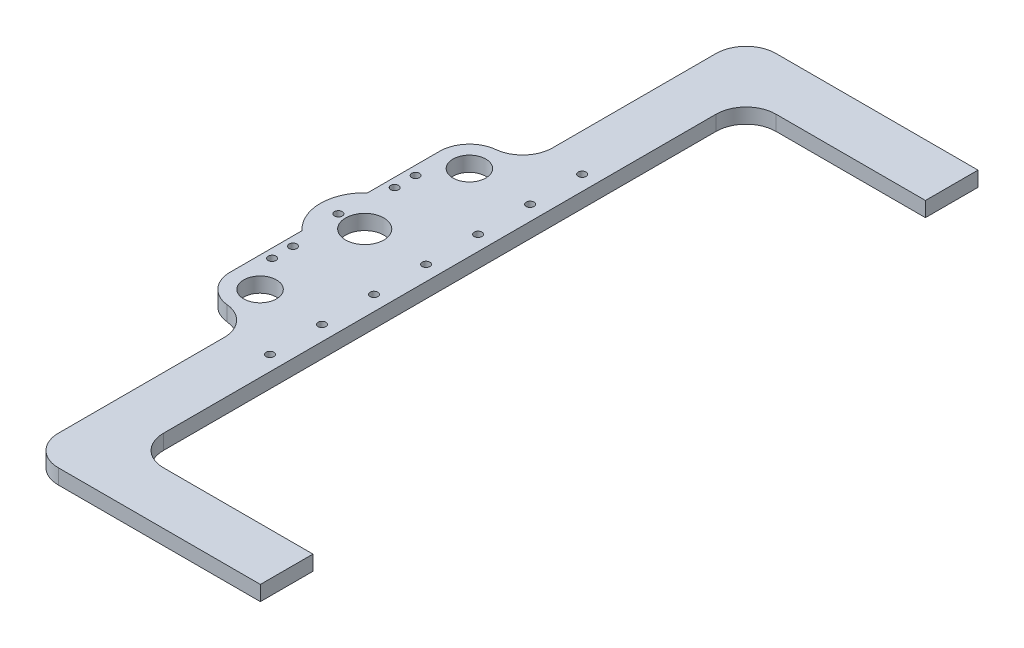
from build123d import *

# Parameters (mm, degrees)
SKETCH1_R           = 8.128
SKETCH1_R_2         = 6.985
SKETCH1_R_3         = 1.651
BOSS_EXTRUDE1_DEPTH = 6.35


with BuildPart() as part:
    # Sketch1 → Boss-Extrude1 (new body)
    with BuildSketch(Plane(origin=(0, 0, 0), x_dir=(1, 0, 0), z_dir=(0, 1, 0))):
        with BuildLine():
            Line((-67.971311517, -52.728298572), (-67.971311517, -82.586411585))
            ThreePointArc((-67.971311517, -82.586411585), (-64.941959488, -91.499608698), (-56.608448003, -95.878494725))
            ThreePointArc((-56.608448003, -95.878494725), (-48.492989851, -100.008926653), (-45.228378476, -108.509717293))
            Line((-45.228378476, -108.509717293), (-45.228378476, -114.997272158))
            Line((-45.228378476, -114.997272158), (-45.228378476, -128.204620988))
            Line((-45.228378476, -128.204620988), (-45.228378476, -179.004620988))
            ThreePointArc((-45.228378476, -179.004620988), (-41.508634597, -187.984877109), (-32.528378476, -191.704620988))
            Line((-32.528378476, -191.704620988), (-22.903517531, -191.704620988))
            Line((-22.903517531, -191.704620988), (53.296482469, -191.704620988))
            Line((53.296482469, -191.704620988), (53.296482469, -169.379760042))
            Line((53.296482469, -169.379760042), (-10.203517531, -169.379760042))
            ThreePointArc((-10.203517531, -169.379760042), (-19.183773652, -165.660016163), (-22.903517531, -156.679760042))
            Line((-22.903517531, -156.679760042), (-22.903517531, -128.204620988))
            Line((-22.903517531, -128.204620988), (-22.903517531, 49.595379012))
            Line((-22.903517531, 49.595379012), (-22.903517531, 78.070518067))
            ThreePointArc((-22.903517531, 78.070518067), (-19.183773652, 87.050774188), (-10.203517531, 90.770518067))
            Line((-10.203517531, 90.770518067), (53.296482469, 90.770518067))
            Line((53.296482469, 90.770518067), (53.296482469, 113.095379012))
            Line((53.296482469, 113.095379012), (-22.903517531, 113.095379012))
            Line((-22.903517531, 113.095379012), (-32.528378476, 113.095379012))
            ThreePointArc((-32.528378476, 113.095379012), (-41.508634597, 109.375635133), (-45.228378476, 100.395379012))
            Line((-45.228378476, 100.395379012), (-45.228378476, 49.595379012))
            Line((-45.228378476, 49.595379012), (-45.228378476, 37.402727842))
            Line((-45.228378476, 37.402727842), (-45.228378476, 30.915172977))
            ThreePointArc((-45.228378476, 30.915172977), (-48.492989851, 22.414382337), (-56.608448003, 18.28395041))
            ThreePointArc((-56.608448003, 18.28395041), (-64.941959488, 13.905064383), (-67.971311517, 4.991867269))
            Line((-67.971311517, 4.991867269), (-67.971311517, -24.866245744))
            ThreePointArc((-67.971311517, -24.866245744), (-74.128017531, -38.797272158), (-67.971311517, -52.728298572))
        make_face()
        with Locations((-55.288517531, -38.797272158)):
            Circle(SKETCH1_R, mode=Mode.SUBTRACT)
        with Locations((-55.288517531, 5.652727842)):
            Circle(SKETCH1_R_2, mode=Mode.SUBTRACT)
        with Locations((-55.288517531, -83.247272158)):
            Circle(SKETCH1_R_2, mode=Mode.SUBTRACT)
        with Locations((-29.253517531, -38.797272158)):
            Circle(SKETCH1_R_3, mode=Mode.SUBTRACT)
        with Locations((-29.253517531, -16.699272158)):
            Circle(SKETCH1_R_3, mode=Mode.SUBTRACT)
        with Locations((-29.253517531, 5.398727842)):
            Circle(SKETCH1_R_3, mode=Mode.SUBTRACT)
        with Locations((-29.253517531, 27.496727842)):
            Circle(SKETCH1_R_3, mode=Mode.SUBTRACT)
        with Locations((-29.253517531, -60.895272158)):
            Circle(SKETCH1_R_3, mode=Mode.SUBTRACT)
        with Locations((-29.253517531, -82.993272158)):
            Circle(SKETCH1_R_3, mode=Mode.SUBTRACT)
        with Locations((-29.253517531, -105.091272158)):
            Circle(SKETCH1_R_3, mode=Mode.SUBTRACT)
        with Locations((-66.464517531, -38.797272158)):
            Circle(SKETCH1_R_3, mode=Mode.SUBTRACT)
        with Locations((-64.161311517, -60.387272158)):
            Circle(SKETCH1_R_3, mode=Mode.SUBTRACT)
        with Locations((-64.161311517, -69.277272158)):
            Circle(SKETCH1_R_3, mode=Mode.SUBTRACT)
        with Locations((-64.161311517, -17.207272158)):
            Circle(SKETCH1_R_3, mode=Mode.SUBTRACT)
        with Locations((-64.161311517, -8.317272158)):
            Circle(SKETCH1_R_3, mode=Mode.SUBTRACT)
    extrude(amount=BOSS_EXTRUDE1_DEPTH)


solid = part.part
